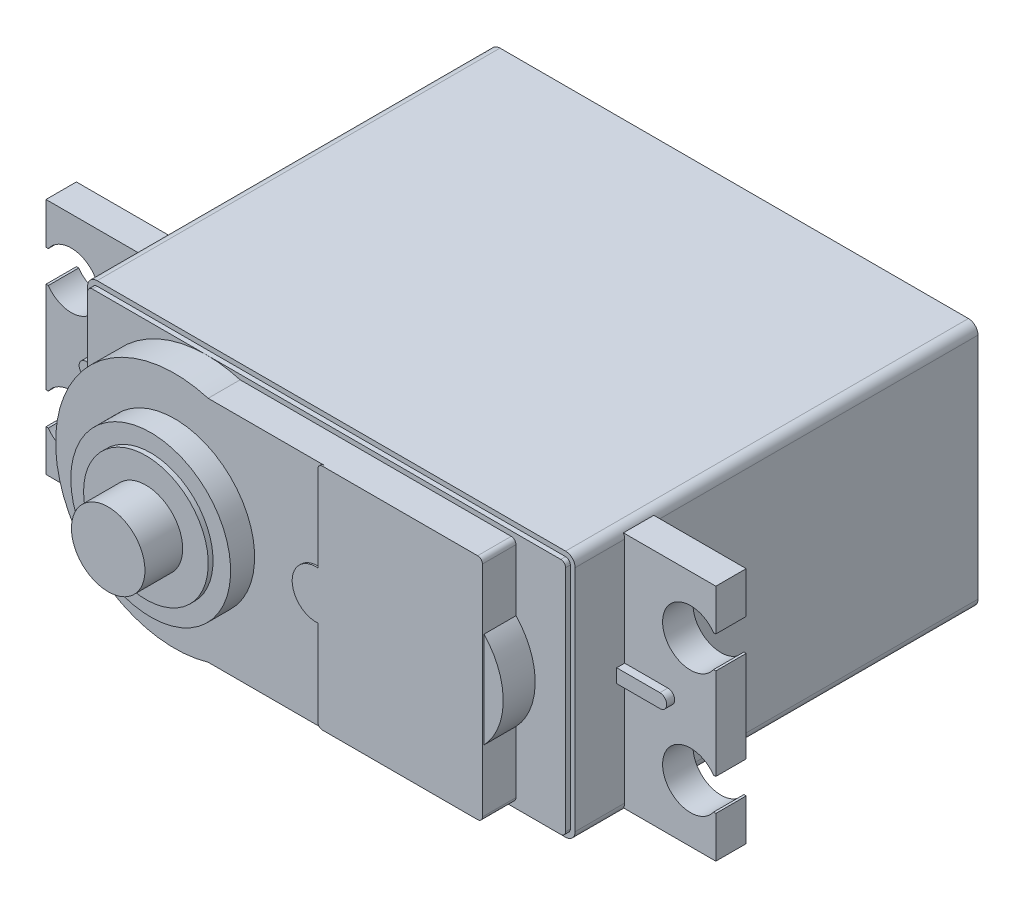
from build123d import *
from build123d.topology import SkipClean

# Parameters (mm, degrees)
EXTRUDE1_DEPTH      = 8.255
EXTRUDE2_DEPTH      = 0.381
EXTRUDE3_DEPTH      = 2.54
SKETCH7_R           = 6.35
EXTRUDE4_DEPTH      = 1.905
SKETCH8_R           = 4.953
EXTRUDE5_DEPTH      = 0.381
SHELL1_DEPTH        = 9.906
SHELL1_2_OUTLINE_W  = 36.195
SHELL1_2_OUTLINE_H  = 17.145
SHELL1_2_DEPTH      = 6.985
SHELL1_START        = 9.906
SHELL1_3_OUTLINE_R  = 5.08
SHELL1_3_DEPTH      = 1.905
SHELL1_START_2      = 6.985
SHELL1_4_DEPTH      = 0.381
SHELL1_START_3      = 11.811
SHELL1_5_OUTLINE_R  = 3.683
SHELL1_5_DEPTH      = 0.381
SKETCH28_R          = 5.08
SKETCH28_R_2        = 5
EXTRUDE14_DEPTH     = 1.905
CUT_EXTRUDE2_DEPTH  = 0.889
SKETCH12_R          = 1.905
EXTRUDE6_DEPTH      = 7.112
SKETCH9_R           = 8.89
CUT_EXTRUDE3_DEPTH  = 45.069914976
CUT_EXTRUDE5_START  = -0.381
CUT_EXTRUDE5_DEPTH  = 0.381
SKETCH14_R          = 0.79375
CUT_EXTRUDE6_DEPTH  = 6.35
EXTRUDE7_START      = -0.254
SKETCH16_W          = 2.413
SKETCH16_H          = 18.923
EXTRUDE7_DEPTH      = 7.493
EXTRUDE8_DEPTH      = 0.635
SKETCH19_R          = 2.2225
CUT_EXTRUDE7_DEPTH  = 51.840147885
SKETCH20_W          = 2.413
SKETCH20_H          = 2.54
CUT_EXTRUDE8_DEPTH  = 2.54
EXTRUDE10_START     = 2.54
EXTRUDE10_DEPTH     = 2.54
SKETCH23_R          = 8.255
CUT_EXTRUDE10_DEPTH = 51.982710177
SKETCH24_R          = 1.905
EXTRUDE11_DEPTH     = 0.508
SKETCH25_R          = 0.79375
CUT_EXTRUDE11_DEPTH = 0.762
EXTRUDE12_START     = 0.0508
SKETCH26_R          = 5.7658
EXTRUDE12_DEPTH     = 0.0508
EXTRUDE13_DEPTH     = 0.127
SKETCH29_R          = 2.921
CUT_EXTRUDE12_DEPTH = 1.27
BOSS_EXTRUDE1_START = 23.749
BOSS_EXTRUDE1_DEPTH = 23.749
SKETCH31_R          = 2.921
BOSS_EXTRUDE3_DEPTH = 2.9972


# Read off the part's stored shape, not the designer's step: Shell1
with BuildPart() as part:
    # Sketch2 → Extrude1 (new body)
    with BuildSketch(Plane.XY):
        with BuildLine():
            Line((0.762, 0), (37.973, 0))
            ThreePointArc((37.973, 0), (38.511815367, 0.223184633), (38.735, 0.762))
            Line((38.735, 0.762), (38.735, 18.923))
            ThreePointArc((38.735, 18.923), (38.511815367, 19.461815367), (37.973, 19.685))
            Line((37.973, 19.685), (0.762, 19.685))
            ThreePointArc((0.762, 19.685), (0.223184633, 19.461815367), (0, 18.923))
            Line((0, 18.923), (0, 0.762))
            ThreePointArc((0, 0.762), (0.223184633, 0.223184633), (0.762, 0))
        make_face()
    extrude(amount=EXTRUDE1_DEPTH)

    # Sketch4 → Extrude2 (add)
    with BuildSketch(Plane.XY.offset(8.255)):
        with BuildLine():
            Line((37.973, 19.304), (0.762, 19.304))
            ThreePointArc((0.762, 19.304), (0.492592316, 19.192407684), (0.381, 18.923))
            Line((0.381, 18.923), (0.381, 0.762))
            ThreePointArc((0.381, 0.762), (0.492592316, 0.492592316), (0.762, 0.381))
            Line((0.762, 0.381), (37.973, 0.381))
            ThreePointArc((37.973, 0.381), (38.242407684, 0.492592316), (38.354, 0.762))
            Line((38.354, 0.762), (38.354, 18.923))
            ThreePointArc((38.354, 18.923), (38.242407684, 19.192407684), (37.973, 19.304))
        make_face()
    extrude(amount=EXTRUDE2_DEPTH)

    # Sketch5 → Extrude3 (add)
    with BuildSketch(Plane.XY.offset(8.636)):
        with BuildLine():
            Line((12.500413091, 18.923), (34.036, 18.923))
            ThreePointArc((34.036, 18.923), (34.305407684, 18.811407684), (34.417, 18.542))
            Line((34.417, 18.542), (34.417, 13.6525))
            ThreePointArc((34.417, 13.6525), (35.941, 9.8425), (34.417, 6.0325))
            Line((34.417, 6.0325), (34.417, 1.143))
            ThreePointArc((34.417, 1.143), (34.305407684, 0.873592316), (34.036, 0.762))
            Line((34.036, 0.762), (12.500413091, 0.762))
            ThreePointArc((12.500413091, 0.762), (0.381, 9.8425), (12.500413091, 18.923))
        make_face()
    extrude(amount=EXTRUDE3_DEPTH)

    # Sketch7 → Extrude4 (add)
    with BuildSketch(Plane.XY.offset(11.176)):
        with Locations(Location((9.8425, 9.8425, 0), (0, 0, 180))):
            Circle(SKETCH7_R)
    extrude(amount=EXTRUDE4_DEPTH)

    # Sketch8 → Extrude5 (add)
    with BuildSketch(Plane.XY.offset(13.081)):
        with Locations(Location((9.8425, 9.8425, 0), (0, 0, 180))):
            Circle(SKETCH8_R)
    extrude(amount=EXTRUDE5_DEPTH)

    # Shell1 outline → Shell1 (cut)
    with BuildSketch(Plane.XY):
        with BuildLine():
            ThreePointArc((12.311662206, 17.653), (1.651, 9.8425), (12.311662206, 2.032))
            Line((12.311662206, 2.032), (33.147, 2.032))
            Line((33.147, 2.032), (33.147, 6.579810925))
            ThreePointArc((33.147, 6.579810925), (34.671, 9.8425), (33.147, 13.105189075))
            Line((33.147, 13.105189075), (33.147, 17.653))
            Line((33.147, 17.653), (12.311662206, 17.653))
        make_face()
    extrude(amount=SHELL1_DEPTH, mode=Mode.SUBTRACT)

    # Shell1 2 outline → Shell1 2 (cut)
    with BuildSketch(Plane.XY):
        with Locations((19.3675, 9.8425)):
            Rectangle(SHELL1_2_OUTLINE_W, SHELL1_2_OUTLINE_H)
        with BuildLine():
            Line((12.311662206, 17.653), (33.147, 17.653))
            Line((33.147, 17.653), (33.147, 13.105189075))
            ThreePointArc((33.147, 13.105189075), (34.671, 9.8425), (33.147, 6.579810925))
            Line((33.147, 6.579810925), (33.147, 2.032))
            Line((33.147, 2.032), (12.311662206, 2.032))
            ThreePointArc((12.311662206, 2.032), (1.651, 9.8425), (12.311662206, 17.653))
        make_face(mode=Mode.SUBTRACT)
    extrude(amount=SHELL1_2_DEPTH, mode=Mode.SUBTRACT)

    # Shell1 3 outline → Shell1 3 (cut)
    with BuildSketch(Plane.XY.offset(SHELL1_START)):
        with Locations((9.8425, 9.8425)):
            Circle(SHELL1_3_OUTLINE_R)
    extrude(amount=SHELL1_3_DEPTH, mode=Mode.SUBTRACT)

    # Shell1 4 outline → Shell1 4 (cut)
    with BuildSketch(Plane.XY.offset(SHELL1_START_2)):
        with BuildLine():
            Line((9.8425, 18.034), (1.651, 18.034))
            Line((1.651, 18.034), (1.651, 9.8425))
            ThreePointArc((1.651, 9.8425), (4.050234802, 15.634765198), (9.8425, 18.034))
        make_face()
        with BuildLine():
            Line((37.084, 18.034), (9.8425, 18.034))
            ThreePointArc((9.8425, 18.034), (11.091692039, 17.938189686), (12.311662206, 17.653))
            Line((12.311662206, 17.653), (33.147, 17.653))
            Line((33.147, 17.653), (33.147, 13.105189075))
            ThreePointArc((33.147, 13.105189075), (34.671, 9.8425), (33.147, 6.579810925))
            Line((33.147, 6.579810925), (33.147, 2.032))
            Line((33.147, 2.032), (12.311662206, 2.032))
            ThreePointArc((12.311662206, 2.032), (11.091692, 1.746810308), (9.842499922, 1.651))
            Line((9.842499922, 1.651), (37.084, 1.651))
            Line((37.084, 1.651), (37.084, 18.034))
        make_face()
        with BuildLine():
            ThreePointArc((9.842499922, 1.651), (4.050234774, 4.05023483), (1.651, 9.8425))
            Line((1.651, 9.8425), (1.651, 1.651))
            Line((1.651, 1.651), (9.842499922, 1.651))
        make_face()
    extrude(amount=SHELL1_4_DEPTH, mode=Mode.SUBTRACT)

    # Shell1 5 outline → Shell1 5 (cut)
    with BuildSketch(Plane.XY.offset(SHELL1_START_3)):
        with Locations((9.8425, 9.8425)):
            Circle(SHELL1_5_OUTLINE_R)
    extrude(amount=SHELL1_5_DEPTH, mode=Mode.SUBTRACT)

    # Sketch28 → Extrude14 (add)
    with BuildSketch(Plane(origin=(0, 0, 9.906), x_dir=(-1, 0, 0), z_dir=(0, 0, -1))):
        with Locations((-9.8425, 9.8425)):
            Circle(SKETCH28_R)
        with Locations((-9.8425, 9.8425)):
            Circle(SKETCH28_R_2, mode=Mode.SUBTRACT)
    extrude(amount=-EXTRUDE14_DEPTH)

    # Sketch10 → Cut-Extrude2 (cut)
    with BuildSketch(Plane(origin=(0, 0, 0), x_dir=(-1, 0, 0), z_dir=(0, 0, -1))):
        with BuildLine():
            Line((-38.1, 18.923), (-38.1, 0.762))
            ThreePointArc((-38.1, 0.762), (-38.062802561, 0.672197439), (-37.973, 0.635))
            Line((-37.973, 0.635), (-0.762, 0.635))
            ThreePointArc((-0.762, 0.635), (-0.672197439, 0.672197439), (-0.635, 0.762))
            Line((-0.635, 0.762), (-0.635, 18.923))
            ThreePointArc((-0.635, 18.923), (-0.672197439, 19.012802561), (-0.762, 19.05))
            Line((-0.762, 19.05), (-37.973, 19.05))
            ThreePointArc((-37.973, 19.05), (-38.062802561, 19.012802561), (-38.1, 18.923))
        make_face()
    extrude(amount=-CUT_EXTRUDE2_DEPTH, mode=Mode.SUBTRACT)

    # Sketch12 → Extrude6 (add)
    with BuildSketch(Plane(origin=(0, 0, 0.889), x_dir=(-1, 0, 0), z_dir=(0, 0, -1))):
        with Locations((-2.286, 17.399)):
            Circle(SKETCH12_R)
        with Locations((-2.286, 2.286)):
            Circle(SKETCH12_R)
        with Locations((-36.449, 2.286)):
            Circle(SKETCH12_R)
        with Locations((-36.449, 17.399)):
            Circle(SKETCH12_R)
    extrude(amount=-EXTRUDE6_DEPTH)

    # Sketch9 → Cut-Extrude3 (cut, through all)
    with BuildSketch(Plane(origin=(0, 0, 7.366), x_dir=(-1, 0, 0), z_dir=(0, 0, -1))):
        with Locations((-9.8425, 9.8425)):
            Circle(SKETCH9_R)
    extrude(amount=CUT_EXTRUDE3_DEPTH, mode=Mode.SUBTRACT)

    # Sketch13 → Cut-Extrude5 (cut)
    with SkipClean():  # the faces are left unmerged after this step: merging them gives an invalid solid
        with BuildSketch(Plane(origin=(0, 0, 6.985), x_dir=(-1, 0, 0), z_dir=(0, 0, -1)).offset(CUT_EXTRUDE5_START)):
            with BuildLine():
                Line((-7.48785698, 1.27), (-3.897449348, 1.27))
                ThreePointArc((-3.897449348, 1.27), (-4.189270038, 2.204832495), (-3.978098517, 3.161115769))
                ThreePointArc((-3.978098517, 3.161115769), (-3.556320715, 3.556320715), (-3.161115769, 3.978098517))
                ThreePointArc((-3.161115769, 3.978098517), (-2.204832495, 4.189270038), (-1.27, 3.897449348))
                Line((-1.27, 3.897449348), (-1.27, 7.48785698))
                ThreePointArc((-1.27, 7.48785698), (-0.9525, 9.8425), (-1.27, 12.19714302))
                Line((-1.27, 12.19714302), (-1.27, 15.787550652))
                ThreePointArc((-1.27, 15.787550652), (-2.204832495, 15.495729962), (-3.161115769, 15.706901483))
                ThreePointArc((-3.161115769, 15.706901483), (-3.556320715, 16.128679285), (-3.978098517, 16.523884231))
                ThreePointArc((-3.978098517, 16.523884231), (-4.189270038, 17.480167505), (-3.897449348, 18.415))
                Line((-3.897449348, 18.415), (-7.48785698, 18.415))
                ThreePointArc((-7.48785698, 18.415), (-9.8425, 18.7325), (-12.19714302, 18.415))
                Line((-12.19714302, 18.415), (-34.837550652, 18.415))
                ThreePointArc((-34.837550652, 18.415), (-35.101961582, 16.051961582), (-37.465, 15.787550652))
                Line((-37.465, 15.787550652), (-37.465, 3.897449348))
                ThreePointArc((-37.465, 3.897449348), (-35.101961582, 3.633038418), (-34.837550652, 1.27))
                Line((-34.837550652, 1.27), (-12.19714302, 1.27))
                ThreePointArc((-12.19714302, 1.27), (-9.8425, 0.9525), (-7.48785698, 1.27))
            make_face()
        extrude(amount=CUT_EXTRUDE5_DEPTH, mode=Mode.SUBTRACT)

    # Sketch14 → Cut-Extrude6 (cut)
    with SkipClean():  # the faces are left unmerged after this step: merging them gives an invalid solid
        with BuildSketch(Plane(origin=(0, 0, 0.889), x_dir=(-1, 0, 0), z_dir=(0, 0, -1))):
            with Locations((-2.286, 17.399)):
                Circle(SKETCH14_R)
            with Locations((-2.286, 2.286)):
                Circle(SKETCH14_R)
            with Locations((-36.449, 2.286)):
                Circle(SKETCH14_R)
            with Locations((-36.449, 17.399)):
                Circle(SKETCH14_R)
        extrude(amount=-CUT_EXTRUDE6_DEPTH, mode=Mode.SUBTRACT)

    # Sketch16 → Extrude7 (add)
    with SkipClean():  # the faces are left unmerged after this step: merging them gives an invalid solid
        with BuildSketch(Plane(origin=(38.735, 0, 0), x_dir=(0, 0, -1), z_dir=(1, 0, 0)).offset(EXTRUDE7_START)):
            with Locations((-3.1115, 9.8425)):
                Rectangle(SKETCH16_W, SKETCH16_H)
        extrude7 = extrude(amount=EXTRUDE7_DEPTH)

    # Sketch18 → Extrude8 (add)
    with SkipClean():  # the faces are left unmerged after this step: merging them gives an invalid solid
        with BuildSketch(Plane.XY.offset(4.318)):
            with BuildLine():
                Line((38.735, 10.3886), (42.164, 10.3886))
                ThreePointArc((42.164, 10.3886), (42.7101, 9.8425), (42.164, 9.2964))
                Line((42.164, 9.2964), (38.735, 9.2964))
                Line((38.735, 9.2964), (38.735, 10.3886))
            make_face()
        extrude8 = extrude(amount=EXTRUDE8_DEPTH)

    # Sketch19 → Cut-Extrude7 (cut, through all)
    with SkipClean():  # the faces are left unmerged after this step: merging them gives an invalid solid
        with BuildSketch(Plane.XY.offset(4.318)):
            with Locations((43.9674, 14.7447)):
                Circle(SKETCH19_R)
            with Locations((43.9674, 4.9403)):
                Circle(SKETCH19_R)
        cut_extrude7 = extrude(amount=-CUT_EXTRUDE7_DEPTH, mode=Mode.SUBTRACT)

    # Sketch20 → Cut-Extrude8 (cut)
    with SkipClean():  # the faces are left unmerged after this step: merging them gives an invalid solid
        with BuildSketch(Plane(origin=(45.974, 0, 0), x_dir=(0, 0, -1), z_dir=(1, 0, 0))):
            with Locations((-3.1115, 14.7447)):
                Rectangle(SKETCH20_W, SKETCH20_H)
            with Locations((-3.1115, 4.9403)):
                Rectangle(SKETCH20_W, SKETCH20_H)
        cut_extrude8 = extrude(amount=-CUT_EXTRUDE8_DEPTH, mode=Mode.SUBTRACT)

    # Sketch22 → Extrude10 (add)
    with SkipClean():  # the faces are left unmerged after this step: merging them gives an invalid solid
        with BuildSketch(Plane(origin=(0, 0, 9.906), x_dir=(-1, 0, 0), z_dir=(0, 0, -1)).offset(EXTRUDE10_START)):
            with BuildLine():
                Line((-12.192, 5.428901723), (-12.6746, 2.032))
                Line((-12.6746, 2.032), (-18.536713573, 2.032))
                ThreePointArc((-18.536713573, 2.032), (-15.601429485, 3.784432823), (-13.627847172, 6.575827872))
                ThreePointArc((-13.627847172, 6.575827872), (-12.963068434, 5.935832283), (-12.192, 5.428901723))
            make_face()
            with BuildLine():
                Line((-12.192, 14.256098277), (-12.6746, 17.653))
                Line((-12.6746, 17.653), (-18.536713573, 17.653))
                ThreePointArc((-18.536713573, 17.653), (-15.601429485, 15.900567177), (-13.627847172, 13.109172128))
                ThreePointArc((-13.627847172, 13.109172128), (-12.963068434, 13.749167717), (-12.192, 14.256098277))
            make_face()
        extrude(amount=-EXTRUDE10_DEPTH)

    # Sketch23 → Cut-Extrude10 (cut, through all)
    with SkipClean():  # the faces are left unmerged after this step: merging them gives an invalid solid
        with BuildSketch(Plane(origin=(0, 0, 9.906), x_dir=(-1, 0, 0), z_dir=(0, 0, -1))):
            with Locations((-21.209, 9.8425)):
                Circle(SKETCH23_R)
        extrude(amount=CUT_EXTRUDE10_DEPTH, mode=Mode.SUBTRACT)

    # Sketch24 → Extrude11 (add)
    with SkipClean():  # the faces are left unmerged after this step: merging them gives an invalid solid
        with BuildSketch(Plane(origin=(0, 0, 9.906), x_dir=(-1, 0, 0), z_dir=(0, 0, -1))):
            with Locations(Location((-21.209, 9.8425, 0), (0, 0, 180))):
                Circle(SKETCH24_R)
            with Locations(Location((-30.4165, 9.8425, 0), (0, 0, 180))):
                Circle(SKETCH24_R)
        extrude(amount=EXTRUDE11_DEPTH)

    # Sketch25 → Cut-Extrude11 (cut)
    with SkipClean():  # the faces are left unmerged after this step: merging them gives an invalid solid
        with BuildSketch(Plane(origin=(0, 0, 9.398), x_dir=(-1, 0, 0), z_dir=(0, 0, -1))):
            with Locations((-21.209, 9.8425)):
                Circle(SKETCH25_R)
            with Locations((-30.4165, 9.8425)):
                Circle(SKETCH25_R)
        extrude(amount=-CUT_EXTRUDE11_DEPTH, mode=Mode.SUBTRACT)

    # Sketch26 → Extrude12 (add)
    with SkipClean():  # the faces are left unmerged after this step: merging them gives an invalid solid
        with BuildSketch(Plane(origin=(0, 0, 9.906), x_dir=(-1, 0, 0), z_dir=(0, 0, -1)).offset(EXTRUDE12_START)):
            with Locations((-9.8425, 9.8425)):
                Circle(SKETCH26_R)
            with BuildLine():
                ThreePointArc((-13.627847172, 13.109172128), (-14.8425, 9.8425), (-13.627847172, 6.575827872))
                ThreePointArc((-13.627847172, 6.575827872), (-12.963068434, 5.935832283), (-12.192, 5.428901723))
                ThreePointArc((-12.192, 5.428901723), (-4.8425, 9.8425), (-12.192, 14.256098277))
                ThreePointArc((-12.192, 14.256098277), (-12.963068434, 13.749167717), (-13.627847172, 13.109172128))
            make_face(mode=Mode.SUBTRACT)
        extrude(amount=-EXTRUDE12_DEPTH)

    # Sketch27 → Extrude13 (add)
    with SkipClean():  # the faces are left unmerged after this step: merging them gives an invalid solid
        with BuildSketch(Plane.XY.offset(11.176)):
            with BuildLine():
                Line((21.336, 18.542), (21.336, 11.743261952))
                ThreePointArc((21.336, 11.743261952), (19.304, 9.8425), (21.336, 7.941738048))
                Line((21.336, 7.941738048), (21.336, 1.143))
                ThreePointArc((21.336, 1.143), (21.447592316, 0.873592316), (21.717, 0.762))
                Line((21.717, 0.762), (34.036, 0.762))
                ThreePointArc((34.036, 0.762), (34.305407684, 0.873592316), (34.417, 1.143))
                Line((34.417, 1.143), (34.417, 6.0325))
                Line((34.417, 6.0325), (34.417, 13.6525))
                Line((34.417, 13.6525), (34.417, 18.542))
                ThreePointArc((34.417, 18.542), (34.305407684, 18.811407684), (34.036, 18.923))
                Line((34.036, 18.923), (21.717, 18.923))
                ThreePointArc((21.717, 18.923), (21.447592316, 18.811407684), (21.336, 18.542))
            make_face()
        extrude(amount=EXTRUDE13_DEPTH)

    # Sketch29 → Cut-Extrude12 (cut)
    with SkipClean():  # the faces are left unmerged after this step: merging them gives an invalid solid
        with BuildSketch(Plane.XY.offset(13.462)):
            with Locations((9.8425, 9.8425)):
                Circle(SKETCH29_R)
        extrude(amount=-CUT_EXTRUDE12_DEPTH, mode=Mode.SUBTRACT)

    # Mirror1: Extrude7, Extrude8, Cut-Extrude7, Cut-Extrude8 across plane
    with SkipClean():  # the faces are left unmerged after this step: merging them gives an invalid solid
        add(extrude7.mirror(Plane.ZY.offset(-19.3675)))
        add(extrude8.mirror(Plane.ZY.offset(-19.3675)))
        add(cut_extrude7.mirror(Plane.ZY.offset(-19.3675)), mode=Mode.SUBTRACT)
        add(cut_extrude8.mirror(Plane.ZY.offset(-19.3675)), mode=Mode.SUBTRACT)

    # Sketch30 → Boss-Extrude1 (add)
    with SkipClean():  # the faces are left unmerged after this step: merging them gives an invalid solid
        with BuildSketch(Plane(origin=(0, 0, 0), x_dir=(-1, 0, 0), z_dir=(0, 0, -1)).offset(BOSS_EXTRUDE1_START)):
            with BuildLine():
                Line((-37.973, 19.685), (-0.762, 19.685))
                ThreePointArc((-0.762, 19.685), (-0.223184633, 19.461815367), (0, 18.923))
                Line((0, 18.923), (0, 0.762))
                ThreePointArc((0, 0.762), (-0.223184633, 0.223184633), (-0.762, 0))
                Line((-0.762, 0), (-37.973, 0))
                ThreePointArc((-37.973, 0), (-38.511815367, 0.223184633), (-38.735, 0.762))
                Line((-38.735, 0.762), (-38.735, 18.923))
                ThreePointArc((-38.735, 18.923), (-38.511815367, 19.461815367), (-37.973, 19.685))
            make_face()
        extrude(amount=-BOSS_EXTRUDE1_DEPTH)


with BuildPart() as body_2:
    # Sketch31 → Boss-Extrude3 (new body)
    with BuildSketch(Plane.XY.offset(13.462)):
        with Locations((9.8425, 9.8425)):
            Circle(SKETCH31_R)
    extrude(amount=BOSS_EXTRUDE3_DEPTH)


solid = Compound([part.part, body_2.part])
